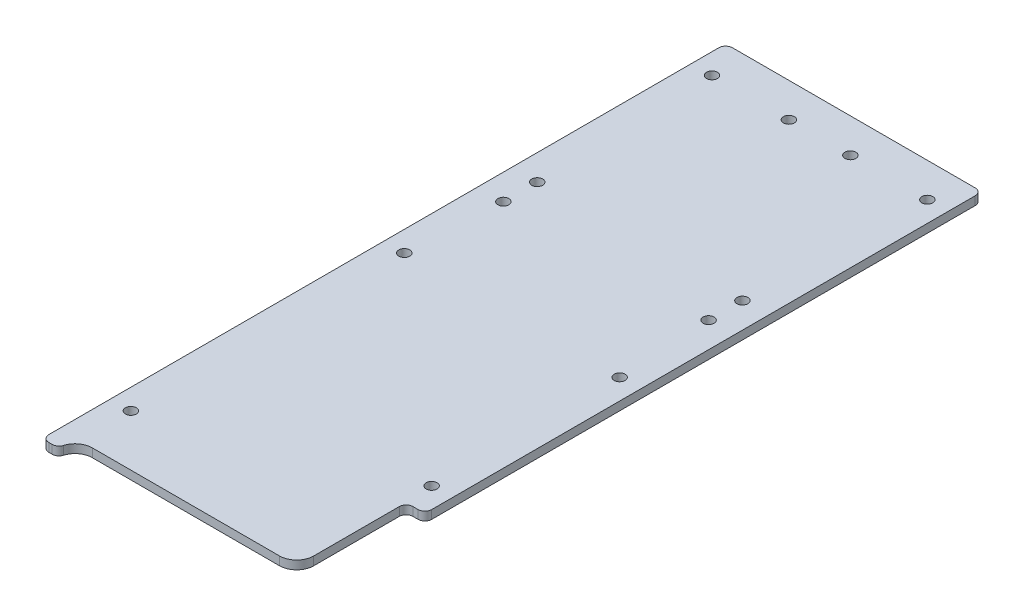
from build123d import *

# Parameters (mm, degrees)
SKETCH1_R           = 2.032
BOSS_EXTRUDE1_DEPTH = 3.175
FILLET1_R           = 2.54
FILLET2_R           = 2.54
FILLET3_R           = 6.35
CUT_EXTRUDE1_DEPTH  = 136.673215063
FILLET4_R           = 6.35
FILLET5_R           = 2.54
SKETCH3_R           = 2.032
CUT_EXTRUDE2_DEPTH  = 136.673215063


with BuildPart() as part:
    # Sketch1 → Boss-Extrude1 (new body)
    with BuildSketch(Plane(origin=(0, 0, 0), x_dir=(1, 0, 0), z_dir=(0, 1, 0))):
        Polygon((47.625, 127), (-47.625, 127), (-47.625, -127), (-41.275, -127), (-41.275, -120.65), (41.275, -120.65), (41.275, -127), (47.625, -127), align=None)
        with Locations((-39.999684148, -101.6)):
            Circle(SKETCH1_R, mode=Mode.SUBTRACT)
        with Locations((39.999684148, -69.85)):
            Circle(SKETCH1_R, mode=Mode.SUBTRACT)
        with Locations((-39.999684148, 0)):
            Circle(SKETCH1_R, mode=Mode.SUBTRACT)
        with Locations((-39.999684148, 114.3)):
            Circle(SKETCH1_R, mode=Mode.SUBTRACT)
        with Locations((-11.424684148, 114.3)):
            Circle(SKETCH1_R, mode=Mode.SUBTRACT)
        with Locations((39.999684148, 0)):
            Circle(SKETCH1_R, mode=Mode.SUBTRACT)
        with Locations((11.424684148, 114.3)):
            Circle(SKETCH1_R, mode=Mode.SUBTRACT)
        with Locations((39.999684148, 114.3)):
            Circle(SKETCH1_R, mode=Mode.SUBTRACT)
    extrude(amount=BOSS_EXTRUDE1_DEPTH)

    # Fillet1
    fillet1_edges = [part.edges().sort_by_distance(p)[0] for p in [
        (-47.625, 1.5875, -127),
        (47.625, 1.5875, -127),
        (47.625, 1.5875, 127),
        (-47.625, 1.5875, 127),
    ]]
    fillet(fillet1_edges, radius=FILLET1_R)

    # Fillet2
    fillet2_edges = [part.edges().sort_by_distance(p)[0] for p in [
        (41.275, 1.5875, 127),
        (-41.275, 1.5875, 127),
    ]]
    fillet(fillet2_edges, radius=FILLET2_R)

    # Fillet3
    fillet3_edges = [part.edges().sort_by_distance(p)[0] for p in [
        (41.275, 1.5875, 120.65),
        (-41.275, 1.5875, 120.65),
    ]]
    fillet(fillet3_edges, radius=FILLET3_R)

    # Sketch2 → Cut-Extrude1 (cut, through all)
    with BuildSketch(Plane.XZ):
        with BuildLine():
            Line((47.625, 131.883089137), (41.910483213, 131.883089137))
            Line((41.910483213, 131.883089137), (41.910483213, 126.140599836))
            ThreePointArc((41.910483213, 126.140599836), (41.593763121, 125.691952405), (41.380880287, 125.185714286))
            ThreePointArc((41.380880287, 125.185714286), (41.067390743, 124.352602721), (40.640483213, 123.571513396))
            Line((40.640483213, 123.571513396), (40.640483213, 79.981419179))
            Line((40.640483213, 79.981419179), (47.625, 79.981419179))
            Line((47.625, 79.981419179), (47.625, 131.883089137))
        make_face()
    extrude(amount=-CUT_EXTRUDE1_DEPTH, mode=Mode.SUBTRACT)

    # Fillet4
    fillet4_edges = [part.edges().sort_by_distance(p)[0] for p in [
        (40.640483213, 1.5875, 123.571513396),
    ]]
    fillet(fillet4_edges, radius=FILLET4_R)

    # Fillet5
    fillet5_edges = [part.edges().sort_by_distance(p)[0] for p in [
        (47.625, 1.5875, 79.981419179),
        (40.640483213, 1.5875, 79.981419179),
    ]]
    fillet(fillet5_edges, radius=FILLET5_R)

    # Sketch3 → Cut-Extrude2 (cut, through all)
    with BuildSketch(Plane.XZ):
        with Locations((-38.113440212, -34.913768806)):
            Circle(SKETCH3_R)
        with Locations((-38.113440212, -47.490173279)):
            Circle(SKETCH3_R)
        with Locations((38.113440212, -47.490173279)):
            Circle(SKETCH3_R)
        with Locations((38.113440212, -34.913768806)):
            Circle(SKETCH3_R)
    extrude(amount=-CUT_EXTRUDE2_DEPTH, mode=Mode.SUBTRACT)


solid = part.part
